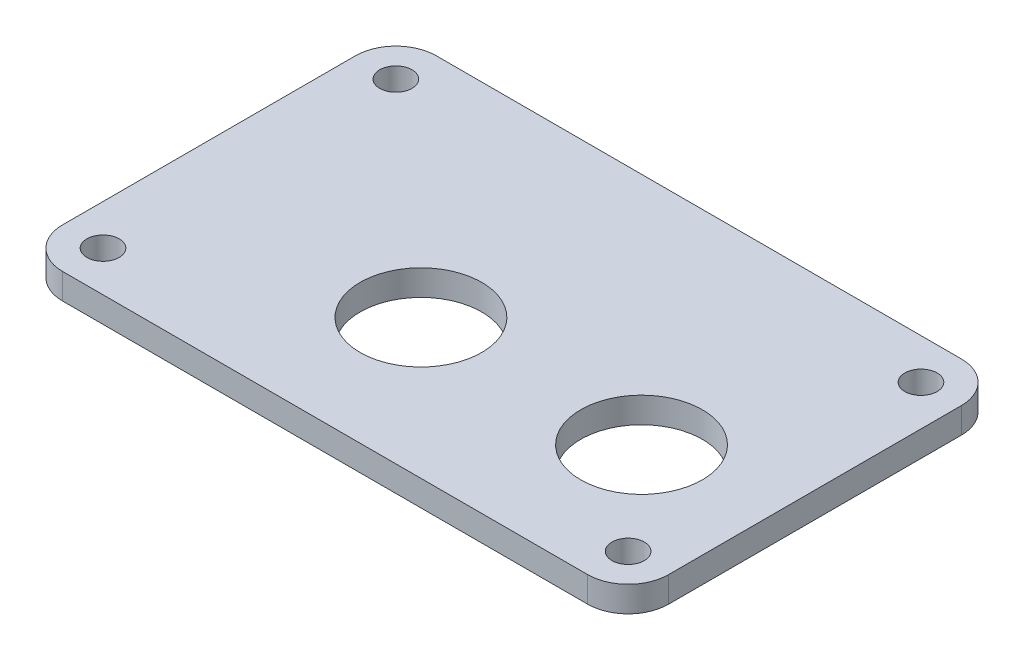
from build123d import *

# Parameters (mm, degrees)
SKETCH1_W           = 60
SKETCH1_H           = 37
BOSS_EXTRUDE1_DEPTH = 2.54
FILLET1_R           = 4
SKETCH2_R           = 1.6
CUT_EXTRUDE1_DEPTH  = 36.33697214
SKETCH3_R           = 6.0198
CUT_EXTRUDE2_DEPTH  = 36.33697214


with BuildPart() as part:
    # Sketch1 → Boss-Extrude1 (new body)
    with BuildSketch(Plane(origin=(0, 0, 0), x_dir=(1, 0, 0), z_dir=(0, 1, 0))):
        Rectangle(SKETCH1_W, SKETCH1_H)
    extrude(amount=BOSS_EXTRUDE1_DEPTH)

    # Fillet1
    fillet1_edges = [part.edges().sort_by_distance(p)[0] for p in [
        (-30, 1.27, -18.5),
        (30, 1.27, -18.5),
        (30, 1.27, 18.5),
        (-30, 1.27, 18.5),
    ]]
    fillet(fillet1_edges, radius=FILLET1_R)

    # Sketch2 → Cut-Extrude1 (cut, through all)
    with BuildSketch(Plane(origin=(0, 2.54, 0), x_dir=(1, 0, 0), z_dir=(0, 1, 0))):
        with Locations((-26, 14.5)):
            Circle(SKETCH2_R)
        with Locations((-26, -14.5)):
            Circle(SKETCH2_R)
        with Locations((26, -14.5)):
            Circle(SKETCH2_R)
        with Locations((26, 14.5)):
            Circle(SKETCH2_R)
    extrude(amount=-CUT_EXTRUDE1_DEPTH, mode=Mode.SUBTRACT)

    # Sketch3 → Cut-Extrude2 (cut, through all)
    with BuildSketch(Plane(origin=(0, 2.54, 0), x_dir=(1, 0, 0), z_dir=(0, 1, 0))):
        with Locations((-4.318, -4.699)):
            Circle(SKETCH3_R)
        with Locations((17.526, -4.699)):
            Circle(SKETCH3_R)
    extrude(amount=-CUT_EXTRUDE2_DEPTH, mode=Mode.SUBTRACT)


solid = part.part
